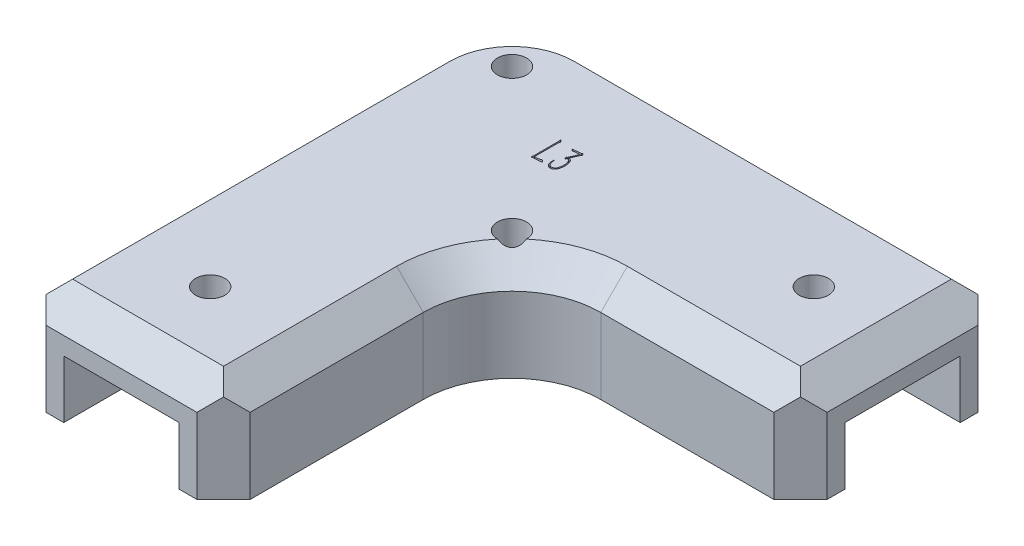
from build123d import *

# Parameters (mm, degrees)
SKETCH_1_W          = 23
SKETCH_1_H          = 23
SKETCH_1_W_2        = 13
SKETCH_1_H_2        = 13
EXTRUDE_1_DEPTH     = 55.5
SKETCH_2_R          = 1.65
CUT_EXTRUDE_1_DEPTH = 34
SKETCH_4_W          = 23
SKETCH_4_H          = 23
SKETCH_4_R          = 3
EXTRUDE_2_DEPTH     = 22.5
SKETCH_5_W          = 23
SKETCH_5_H          = 23
SKETCH_5_W_2        = 13
SKETCH_5_H_2        = 13
EXTRUDE_1_2_DEPTH   = 10
SKETCH_6_R          = 1.65
CUT_EXTRUDE_2_DEPTH = 39
SKETCH_7_W          = 13
SKETCH_7_H          = 13
CUT_EXTRUDE_3_DEPTH = 32
CHAMFER_1_SIZE      = 3
SKETCH_8_W          = 55.5
SKETCH_8_H          = 55.5
CUT_EXTRUDE_4_DEPTH = 11.5
EXTRUDE_3_DEPTH     = 6.5
FILLET_1_R          = 10
FILLET_2_R          = 10
SKETCH_10_R         = 1.65
CUT_EXTRUDE_5_DEPTH = 28.5
CHAMFER_3_SIZE      = 3
CHAMFER_4_SIZE      = 3
CHAMFER_5_SIZE      = 3
CUT_EXTRUDE_6_DEPTH = 0.3


with BuildPart() as part:
    # 草图1 → Extrude 1 (new body)
    with BuildSketch(Plane.XY):
        with Locations((6.5, 6.5)):
            Rectangle(SKETCH_1_W, SKETCH_1_H)
        with Locations((6.5, 6.5)):
            Rectangle(SKETCH_1_W_2, SKETCH_1_H_2, mode=Mode.SUBTRACT)
    extrude(amount=EXTRUDE_1_DEPTH)

    # 草图2 → 切除-拉伸1 (cut)
    with BuildSketch(Plane.XZ.offset(5)):
        with Locations(Location((6.5, 45.5, 0), (0, 0, 270))):
            Circle(SKETCH_2_R)
    extrude(amount=-CUT_EXTRUDE_1_DEPTH, mode=Mode.SUBTRACT)

    # 草图4 → 凸台-拉伸2 (add)
    with BuildSketch(Plane(origin=(18, 0, 0), x_dir=(0, 0, -1), z_dir=(1, 0, 0))):
        with Locations((-11.5, 6.5)):
            Rectangle(SKETCH_4_W, SKETCH_4_H)
        with Locations(Location((-11.5, 6.5, 0), (0, 0, 270))):
            Circle(SKETCH_4_R, mode=Mode.SUBTRACT)
    extrude(amount=EXTRUDE_2_DEPTH)

    # 草图5 → Extrude 1 2 (add)
    with BuildSketch(Plane(origin=(40.5, 0, 0), x_dir=(0, 0, -1), z_dir=(1, 0, 0))):
        with Locations((-11.5, 6.5)):
            Rectangle(SKETCH_5_W, SKETCH_5_H)
        with Locations((-11.5, 6.5)):
            Rectangle(SKETCH_5_W_2, SKETCH_5_H_2, mode=Mode.SUBTRACT)
    extrude(amount=EXTRUDE_1_2_DEPTH)

    # 草图6 → 切除-拉伸2 (cut)
    with BuildSketch(Plane(origin=(0, 18, 0), x_dir=(1, 0, 0), z_dir=(0, 1, 0))):
        with Locations(Location((40.5, -11.5, 0), (0, 0, 270))):
            Circle(SKETCH_6_R)
    extrude(amount=-CUT_EXTRUDE_2_DEPTH, mode=Mode.SUBTRACT)

    # 草图7 → 切除-拉伸3 (cut)
    with BuildSketch(Plane(origin=(40.5, 0, 0), x_dir=(0, 0, -1), z_dir=(1, 0, 0))):
        with Locations((-11.5, 6.5)):
            Rectangle(SKETCH_7_W, SKETCH_7_H)
    extrude(amount=-CUT_EXTRUDE_3_DEPTH, mode=Mode.SUBTRACT)

    # 倒角1
    chamfer_1_edges = [part.edges().sort_by_distance(p)[0] for p in [
        (13, 6.5, 18),
    ]]
    chamfer(chamfer_1_edges, length=CHAMFER_1_SIZE)

    # 草图8 → 切除-拉伸4 (cut)
    with BuildSketch(Plane.XZ.offset(5)):
        with Locations((22.75, 27.75)):
            Rectangle(SKETCH_8_W, SKETCH_8_H)
    extrude(amount=-CUT_EXTRUDE_4_DEPTH, mode=Mode.SUBTRACT)

    # 草图9 → 凸台-拉伸3 (add)
    with BuildSketch(Plane.XZ.offset(-13)):
        Polygon((13, 5), (0, 18), (0, 0), (13, 0), align=None)
    extrude(amount=EXTRUDE_3_DEPTH)

    # 圆角1
    fillet_1_edges = [part.edges().sort_by_distance(p)[0] for p in [
        (-5, 12.25, 0),
    ]]
    fillet(fillet_1_edges, radius=FILLET_1_R)

    # 圆角2
    fillet_2_edges = [part.edges().sort_by_distance(p)[0] for p in [
        (18, 12.25, 23),
    ]]
    fillet(fillet_2_edges, radius=FILLET_2_R)

    # 草图10 → 切除-拉伸5 (cut)
    with BuildSketch(Plane.XZ.offset(-6.5)):
        with Locations(Location((2, 7, 0), (0, 0, 270))):
            Circle(SKETCH_10_R)
        with Locations(Location((18, 23, 0), (0, 0, 270))):
            Circle(SKETCH_10_R)
    extrude(amount=-CUT_EXTRUDE_5_DEPTH, mode=Mode.SUBTRACT)

    # 倒角3
    # the kernel refuses this chamfer: 3 mm, written as the material it takes off along each edge
    with BuildSketch(Plane(origin=(5, 18, 10), x_dir=(0, 0, -1), z_dir=(1, 0, 0))) as chamfer_3_piece_1:
        Polygon((10 - CHAMFER_3_SIZE, 0), (10, -CHAMFER_3_SIZE), (10, 0), align=None)
    revolve(axis=Axis((5, 18, 10), (0, 1, 0)), revolution_arc=90, mode=Mode.SUBTRACT)
    with BuildSketch(Plane(origin=(28, 18, 33), x_dir=(-1, 0, 0), z_dir=(0, 0, 1))) as chamfer_3_piece_2:
        Polygon((10 + CHAMFER_3_SIZE, 0), (10, CHAMFER_3_SIZE), (10, 0), align=None)
    revolve(axis=Axis((28, 18, 33), (0, -1, 0)), revolution_arc=90, mode=Mode.SUBTRACT)
    with BuildSketch(Plane(origin=(28, 18, 23), x_dir=(0, 0.027495876610586768, -0.9996219169112968), z_dir=(1, 0, 0))) as chamfer_3_piece_3:
        Polygon((CHAMFER_3_SIZE * 0.999621916911, -CHAMFER_3_SIZE * 0.0274958766106), (-CHAMFER_3_SIZE * 0.0274958766106, -CHAMFER_3_SIZE * 0.999621916911), (0, 0), align=None)
    extrude(amount=30.215048964, mode=Mode.SUBTRACT)
    with BuildSketch(Plane(origin=(58.215048964, 18, 0), x_dir=(0, 0.027495876610586778, 0.9996219169112968), z_dir=(-1, 0, 0)), Plane(origin=(-5, 18, 10), x_dir=(0.9996219169112968, 0.027495876610586778, 0), z_dir=(0, 0, 1))) as chamfer_3_piece_4:
        Polygon((CHAMFER_3_SIZE * 0.999621916911, -CHAMFER_3_SIZE * 0.0274958766106), (-CHAMFER_3_SIZE * 0.0274958766106, -CHAMFER_3_SIZE * 0.999621916911), (0, 0), align=None)
    extrude(amount=53.215048964, mode=Mode.SUBTRACT)
    with BuildSketch(Plane(origin=(18, 18, 33), x_dir=(-0.9996219169112968, 0.02749587661058678, 0), z_dir=(0, 0, 1))) as chamfer_3_piece_5:
        Polygon((CHAMFER_3_SIZE * 0.999621916911, CHAMFER_3_SIZE * 0.0274958766106), (-CHAMFER_3_SIZE * 0.0274958766106, CHAMFER_3_SIZE * 0.999621916911), (0, 0), align=None)
    extrude(amount=30.215048964, mode=Mode.SUBTRACT)

    # 倒角4
    chamfer_4_edges = [part.edges().sort_by_distance(p)[0] for p in [
        (50.5, 18, 11.5),
        (6.5, 18, 55.5),
    ]]
    chamfer(chamfer_4_edges, length=CHAMFER_4_SIZE)

    # 倒角5
    chamfer_5_edges = [part.edges().sort_by_distance(p)[0] for p in [
        (50.5, 10.75, 0),
        (18, 10.75, 55.5),
        (-5, 10.75, 55.5),
        (50.5, 10.75, 23),
    ]]
    chamfer(chamfer_5_edges, length=CHAMFER_5_SIZE)

    # 草图11 → 切除-拉伸6 (cut)
    with BuildSketch(Plane(origin=(0, 18, 0), x_dir=(1, 0, 0), z_dir=(0, 1, 0))):
        with BuildLine():
            Line((11.886448667, -11.428880545), (11.921500873, -11.388607799))
            Line((11.921500873, -11.388607799), (12.143000979, -11.665296484))
            add(Edge.make_bspline(
                [(12.143000979, -11.665296484), (12.1365992, -11.677258545), (12.123954433, -11.700885958), (12.103056101, -11.737286501), (12.086672943, -11.782845201), (12.076075349, -11.840148489), (12.068582909, -11.908480213), (12.067987913, -11.957374288), (12.067676027, -11.983003707)],
                knots=[0, 0, 0, 0, 0.736410598, 1.454555069, 2.274010016, 3.348139226, 4.609940921, 6, 6, 6, 6], degree=3))
            Line((12.067676027, -11.983003707), (12.067676027, -14.55001841))
            add(Edge.make_bspline(
                [(12.067676027, -14.55001841), (12.088313574, -14.550238928), (12.126114842, -14.550642845), (12.176794295, -14.5482061), (12.216385602, -14.548423732), (12.248730371, -14.545726317), (12.283215165, -14.541109754), (12.327935567, -14.535183696), (12.387692514, -14.527938597), (12.457268281, -14.51797461), (12.527863337, -14.507483626), (12.589557624, -14.498041163), (12.637514067, -14.489615764), (12.682624918, -14.4818102), (12.726923753, -14.466437416), (12.765797421, -14.438079484), (12.790790947, -14.409309265), (12.810245687, -14.401985267), (12.81719659, -14.399368506)],
                knots=[0, 0, 0, 0, 1.271684107, 2.329311289, 3.126176351, 3.710204741, 4.32783396, 5.270448411, 6.49050515, 8.03759688, 9.602040843, 10.889228832, 11.884182716, 12.602334394, 13.712376462, 14.732953672, 15.547302315, 16, 16, 16, 16], degree=3))
            add(Edge.make_bspline(
                [(12.81719659, -14.399368506), (12.820446714, -14.401831631), (12.829887667, -14.408986509), (12.848754816, -14.425241073), (12.880035579, -14.451018759), (12.917965236, -14.487770232), (12.956896157, -14.523787751), (12.987863884, -14.552408829), (13.010106052, -14.572824752), (13.018718671, -14.593964744), (13.022311566, -14.611046151), (13.023345524, -14.621107225), (13.023780864, -14.625343362)],
                knots=[0, 0, 0, 0, 0.390394386, 1.134016561, 2.38360509, 4.269889804, 6.18981564, 7.453157385, 8.329021544, 9.032311711, 9.592562279, 10, 10, 10, 10], degree=3))
            add(Edge.make_bspline(
                [(13.023780864, -14.625343362), (13.021699199, -14.630139235), (13.017513892, -14.639781613), (13.002726326, -14.64913431), (12.983618021, -14.654101249), (12.950375219, -14.653540465), (12.902745911, -14.651966363), (12.840964659, -14.661553042), (12.774652399, -14.670750849), (12.722014471, -14.678981675), (12.682022955, -14.684789608), (12.652858967, -14.687361263), (12.616129774, -14.691484081), (12.571567622, -14.69478707), (12.519376611, -14.699416216), (12.459460444, -14.704590782), (12.391878298, -14.710740343), (12.344121345, -14.714403581), (12.319007798, -14.716329938)],
                knots=[0, 0, 0, 0, 0.341365878, 0.68633572, 1.116730632, 1.647491765, 2.890856209, 4.29325764, 5.800779701, 7.359923239, 7.845242571, 8.495183841, 9.311733456, 10.309872826, 11.474601469, 12.805924266, 14.320358265, 16, 16, 16, 16], degree=3))
            Line((12.319007798, -14.716329938), (12.107948774, -14.736466311))
            Line((12.107948774, -14.736466311), (11.991605284, -14.746161602))
            add(Edge.make_bspline(
                [(11.991605284, -14.746161602), (11.979494471, -14.750107691), (11.95986569, -14.756503375), (11.930918978, -14.752383072), (11.918353652, -14.735624924), (11.908618616, -14.717243673), (11.909353524, -14.688586483), (11.914748235, -14.648828341), (11.921724751, -14.594102868), (11.924941487, -14.552758987), (11.926721414, -14.529882037)],
                knots=[0, 0, 0, 0, 1.058270145, 1.715207142, 2.242218181, 2.723015089, 3.427046488, 4.550153686, 6.091084828, 8, 8, 8, 8], degree=3))
            Line((11.926721414, -14.529882037), (11.936416705, -14.233056978))
            Line((11.936416705, -14.233056978), (11.936416705, -11.967342084))
            add(Edge.make_bspline(
                [(11.936416705, -11.967342084), (11.936522304, -11.939249558), (11.936712012, -11.888781073), (11.935608515, -11.821916051), (11.935407553, -11.772171643), (11.933144122, -11.72768195), (11.930435722, -11.680427945), (11.926344521, -11.621833311), (11.916990896, -11.553550933), (11.903530526, -11.50579895), (11.896143958, -11.479594374)],
                knots=[0, 0, 0, 0, 1.372323329, 2.465391677, 3.267017655, 3.801925377, 4.641299591, 5.579257235, 6.671583216, 8, 8, 8, 8], degree=3))
            Line((11.896143958, -11.479594374), (11.886448667, -11.428880545))
        make_face()
        with BuildLine():
            add(Edge.make_bspline(
                [(13.990326784, -12.748185894), (14.001498418, -12.725058849), (14.02301911, -12.680507622), (14.054409059, -12.616154679), (14.083693021, -12.557070603), (14.108739645, -12.502244145), (14.132094483, -12.452884041), (14.152894991, -12.408461874), (14.170868031, -12.368963121), (14.189789846, -12.325111047), (14.209414658, -12.279363158), (14.228413124, -12.23455427), (14.242229033, -12.202546248), (14.249371886, -12.185613332), (14.252099637, -12.179146899)],
                knots=[0, 0, 0, 0, 1.475873638, 2.843077615, 4.114458223, 5.26483622, 6.306479236, 7.252326145, 8.083448402, 8.799989154, 9.996708352, 10.943956596, 11.596712522, 12, 12, 12, 12], degree=3))
            Line((14.252099637, -12.179146899), (14.413190624, -11.751062518))
            add(Edge.make_bspline(
                [(14.413190624, -11.751062518), (14.378154467, -11.754491209), (14.3017073, -11.761972444), (14.204147243, -11.76791256), (14.123029552, -11.77223838), (14.067368946, -11.776902502), (14.018629138, -11.781261925), (13.988582148, -11.784578549), (13.97466516, -11.786114724)],
                knots=[0, 0, 0, 0, 1.440114021, 3.142257811, 3.998086789, 4.76330671, 5.427195687, 6, 6, 6, 6], degree=3))
            Line((13.97466516, -11.786114724), (13.824015256, -11.811471638))
            add(Edge.make_bspline(
                [(13.824015256, -11.811471638), (13.817283811, -11.812886814), (13.79891859, -11.816747799), (13.764955626, -11.827290955), (13.716042686, -11.840256604), (13.67881327, -11.850919137), (13.657703728, -11.856964926)],
                knots=[0, 0, 0, 0, 0.478461291, 1.305373098, 2.472113022, 4, 4, 4, 4], degree=3))
            Line((13.657703728, -11.856964926), (13.607735691, -11.8771013))
            Line((13.607735691, -11.8771013), (13.481696909, -11.690653399))
            add(Edge.make_bspline(
                [(13.481696909, -11.690653399), (13.476374712, -11.68335357), (13.467289152, -11.670891984), (13.459746519, -11.653556663), (13.454147721, -11.641513398), (13.459165757, -11.629385814), (13.479008546, -11.631204366), (13.493990153, -11.641841065), (13.513125853, -11.652074935), (13.535141905, -11.653514266), (13.561833156, -11.655080676), (13.581395504, -11.652040308), (13.592074067, -11.650380652)],
                knots=[0, 0, 0, 0, 1.323589942, 2.259509366, 2.829398404, 3.190947808, 3.965341466, 5.19662492, 6.050472624, 7.088782, 8.410843841, 10, 10, 10, 10], degree=3))
            Line((13.592074067, -11.650380652), (13.753165054, -11.645160111))
            Line((13.753165054, -11.645160111), (14.387833709, -11.569835159))
            Line((14.387833709, -11.569835159), (14.437801746, -11.524341871))
            Line((14.437801746, -11.524341871), (14.478074493, -11.484069124))
            add(Edge.make_bspline(
                [(14.478074493, -11.484069124), (14.479323469, -11.485555857), (14.484443577, -11.491650636), (14.495466254, -11.506153466), (14.515066116, -11.529454206), (14.529884484, -11.548871799), (14.538483613, -11.560139868)],
                knots=[0, 0, 0, 0, 0.23984028, 0.983211964, 2.249351781, 4, 4, 4, 4], degree=3))
            Line((14.538483613, -11.560139868), (14.63469073, -11.680958108))
            add(Edge.make_bspline(
                [(14.63469073, -11.680958108), (14.64115119, -11.68934615), (14.65188745, -11.703285747), (14.659852476, -11.725579176), (14.651690761, -11.740683488), (14.640289338, -11.753630624), (14.621807569, -11.769181126), (14.607164367, -11.780002155), (14.598892733, -11.786114724)],
                knots=[0, 0, 0, 0, 1.419029252, 2.358201718, 2.827787952, 3.596253847, 4.642174893, 6, 6, 6, 6], degree=3))
            Line((14.598892733, -11.786114724), (14.543704154, -11.831608012))
            add(Edge.make_bspline(
                [(14.543704154, -11.831608012), (14.52757562, -11.872141309), (14.49697399, -11.949047551), (14.452883105, -12.058498417), (14.412538144, -12.155815971), (14.377112473, -12.241850124), (14.344573496, -12.315623016), (14.317710647, -12.378221119), (14.293525341, -12.428442494), (14.278732341, -12.457841065), (14.27223601, -12.470751417)],
                knots=[0, 0, 0, 0, 1.507300768, 2.859891598, 4.076963614, 5.147345159, 6.074452096, 6.862861548, 7.500626815, 8, 8, 8, 8], degree=3))
            Line((14.27223601, -12.470751417), (14.120840315, -12.757881185))
            add(Edge.make_bspline(
                [(14.120840315, -12.757881185), (14.138735773, -12.756452338), (14.173008733, -12.753715846), (14.225313503, -12.748492015), (14.282302556, -12.755677348), (14.332286885, -12.775667956), (14.374814824, -12.800334834), (14.40889247, -12.824972197), (14.441448521, -12.856993874), (14.474645686, -12.894637695), (14.507920398, -12.939567549), (14.538508331, -12.993986827), (14.570349978, -13.056128777), (14.610171626, -13.150832112), (14.653200613, -13.277547107), (14.679344326, -13.436701848), (14.692261321, -13.596158531), (14.694157629, -13.702277215), (14.69509985, -13.75500456)],
                knots=[0, 0, 0, 0, 0.660541429, 1.265053373, 1.928435853, 2.750244091, 3.225390118, 3.735570922, 4.291687282, 4.900607759, 5.580848831, 6.342918567, 7.193367346, 8.147740655, 10.119512469, 12.097611575, 14.061014616, 16, 16, 16, 16], degree=3))
            add(Edge.make_bspline(
                [(14.69509985, -13.75500456), (14.693109488, -13.796284439), (14.689328439, -13.874702956), (14.680190539, -13.985514337), (14.666554126, -14.082730264), (14.646695025, -14.192332792), (14.611672045, -14.313422016), (14.568405597, -14.42513801), (14.527324758, -14.505623024), (14.492702743, -14.558992142), (14.45478176, -14.606737638), (14.414030719, -14.648520122), (14.371641228, -14.682856557), (14.330500289, -14.712387016), (14.288869835, -14.733258185), (14.234975485, -14.750693982), (14.169115302, -14.762712585), (14.116660499, -14.765120459), (14.09100865, -14.766297976)],
                knots=[0, 0, 0, 0, 1.512752116, 2.8737433, 4.067977017, 5.104892351, 6.948544146, 8.672095895, 9.482011449, 10.251829035, 10.996496654, 11.710742831, 12.38300564, 12.991319199, 13.561044299, 14.079002633, 15.060579187, 16, 16, 16, 16], degree=3))
            add(Edge.make_bspline(
                [(14.09100865, -14.766297976), (14.069128715, -14.766670929), (14.02703423, -14.767388448), (13.965977284, -14.762417947), (13.91036783, -14.751041378), (13.858215397, -14.735565299), (13.809372953, -14.711091671), (13.762718973, -14.676131185), (13.715753373, -14.633081369), (13.670722763, -14.580251379), (13.629510135, -14.519725706), (13.593474899, -14.452776042), (13.563534579, -14.3803502), (13.533770124, -14.277278267), (13.508542225, -14.145479591), (13.504047806, -14.038775833), (13.501833283, -13.986199957)],
                knots=[0, 0, 0, 0, 0.828828519, 1.594571005, 2.314948186, 2.97625877, 3.650192192, 4.371738268, 5.178272596, 6.059897072, 6.995131469, 7.947518938, 8.935744196, 9.957858231, 12.008325587, 14, 14, 14, 14], degree=3))
            Line((13.501833283, -13.986199957), (13.496612742, -13.790056765))
            Line((13.496612742, -13.790056765), (13.55180132, -13.790056765))
            add(Edge.make_bspline(
                [(13.55180132, -13.790056765), (13.556021518, -13.81914324), (13.56410357, -13.874846419), (13.575859845, -13.95521195), (13.588036157, -14.028470576), (13.60175852, -14.115165163), (13.624612677, -14.212513834), (13.663114962, -14.317286416), (13.715329454, -14.405812638), (13.776635696, -14.478764319), (13.848336999, -14.531716412), (13.925094431, -14.565117493), (14.00332411, -14.580888049), (14.055156335, -14.580691987), (14.080567568, -14.580595866)],
                knots=[0, 0, 0, 0, 0.994021113, 1.903638599, 2.746793397, 3.505624798, 4.871908371, 6.122639036, 7.264652637, 8.331625701, 9.323760524, 10.250011688, 11.142051883, 12, 12, 12, 12], degree=3))
            add(Edge.make_bspline(
                [(14.080567568, -14.580595866), (14.101010523, -14.578833016), (14.141049767, -14.575380327), (14.199111017, -14.562235574), (14.252805994, -14.539806577), (14.303000127, -14.511124775), (14.348179853, -14.473722717), (14.38884185, -14.42965088), (14.423277361, -14.377294594), (14.461869868, -14.297140146), (14.499375862, -14.186636651), (14.527596143, -14.046277872), (14.545959542, -13.903108192), (14.554586567, -13.760655062), (14.555762044, -13.620313995), (14.544222157, -13.528465136), (14.538483613, -13.482790624)],
                knots=[0, 0, 0, 0, 0.647840119, 1.268849254, 1.871153999, 2.479976942, 3.088343857, 3.716462885, 4.367721208, 5.059616847, 6.52246665, 8.039623249, 9.575767262, 11.078710543, 12.547304005, 14, 14, 14, 14], degree=3))
            add(Edge.make_bspline(
                [(14.538483613, -13.482790624), (14.530459431, -13.433560232), (14.514597471, -13.336243077), (14.477905695, -13.219433974), (14.441774528, -13.132209901), (14.409539254, -13.07368949), (14.373001979, -13.021416917), (14.331614543, -12.977575138), (14.289659292, -12.941598128), (14.24754741, -12.917591566), (14.205959705, -12.905238307), (14.179311253, -12.907954237), (14.166333602, -12.90927688)],
                knots=[0, 0, 0, 0, 2.019199264, 3.991492233, 4.943861116, 5.841091039, 6.693606335, 7.520378909, 8.278781735, 8.923571305, 9.475785111, 10, 10, 10, 10], degree=3))
            Line((14.166333602, -12.90927688), (14.085788109, -12.918972171))
            Line((14.085788109, -12.918972171), (14.050735904, -12.984601832))
            add(Edge.make_bspline(
                [(14.050735904, -12.984601832), (14.046057378, -12.992780923), (14.03790156, -13.007039085), (14.026756722, -13.025885163), (14.017855478, -13.036923746), (14.011099232, -13.046439814), (14.001332517, -13.043238596), (13.995050548, -13.032299626), (13.985008243, -13.016195929), (13.978475817, -13.002365204), (13.97466516, -12.994297123)],
                knots=[0, 0, 0, 0, 1.659028505, 2.892093886, 3.763458346, 4.288089223, 4.647361994, 5.327919393, 6.441255868, 8, 8, 8, 8], degree=3))
            Line((13.97466516, -12.994297123), (13.894119667, -12.838426678))
            add(Edge.make_bspline(
                [(13.894119667, -12.838426678), (13.888297682, -12.829468251), (13.878148302, -12.813851158), (13.882548333, -12.796048967), (13.884424376, -12.78845864)],
                knots=[0, 0, 0, 0, 1.147259222, 2, 2, 2, 2], degree=3))
            Line((13.884424376, -12.78845864), (13.924697123, -12.772797017))
            Line((13.924697123, -12.772797017), (13.990326784, -12.748185894))
        make_face()
    extrude(amount=-CUT_EXTRUDE_6_DEPTH, mode=Mode.SUBTRACT)


solid = part.part
